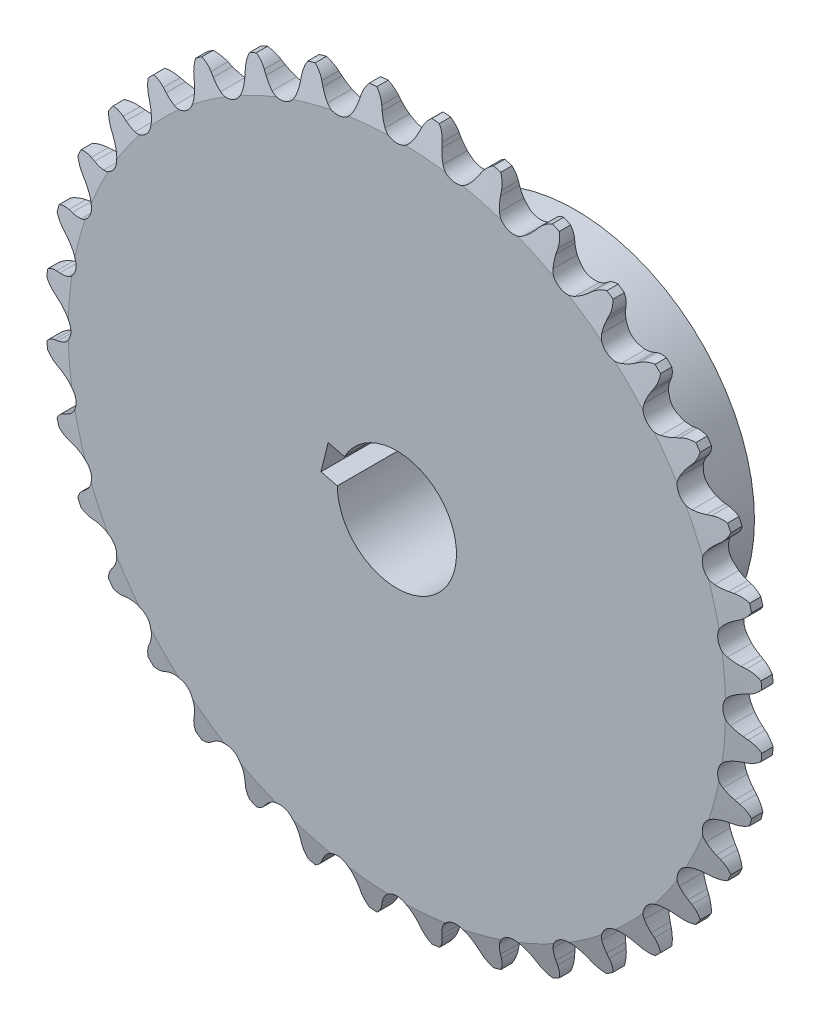
from build123d import *

# Parameters (mm, degrees)
TOOTH_CUT_NUMBER_OF_TEETH_36_DEPTH = 55.034537337
TOOTH_PATTERN_36_36_COUNT          = 36
SKETCH3_W                          = 16.256
SKETCH3_H                          = 19.05
SKETCH4_R                          = 6.35
CUT_EXTRUDE1_DEPTH                 = 58.127539121
CUT_EXTRUDE2_DEPTH                 = 58.127539121
SKETCH7_R                          = 1.5875
CUT_EXTRUDE3_DEPTH                 = 63.533576822
CUT_EXTRUDE3_DRAFT                 = 1
EXTRUDE1_REACH                     = 64.534
EXTRUDE1_END_RADIUS                = 19.05
SKETCH8_R                          = 1.685508898
CUT_EXTRUDE4_START                 = -2.54
CUT_EXTRUDE4_DEPTH                 = 60.993576851
CIRPATTERN1_START                  = 10.275861062
CIRPATTERN1_DEPTH                  = 8.774138938
EXTRUDE2_DEPTH                     = 19.05
CUT_EXTRUDE6_START                 = -19.05
CUT_EXTRUDE6_DEPTH                 = 19.05


# Read off the part's stored shape, not the designer's step: CirPattern1, Cut-Extrude6
with BuildPart() as part:
    # Sprocket-BaseSketch → 25 (04C) ANSI (ISO) Chain Number, 2.868in P.D. (revolve)
    with BuildSketch(Plane(origin=(0, 0, 0), x_dir=(0, 0, -1), z_dir=(1, 0, 0)), mode=Mode.PRIVATE) as f_25_04c_ansi_iso_chain_number_2_868i_sk:
        Polygon((1.397, 0), (1.397, 35.020416061), (0.60325, 38.195416061), (-0.60325, 38.195416061), (-1.397, 35.020416061), (-1.397, 0), align=None)
    revolve(f_25_04c_ansi_iso_chain_number_2_868i_sk.sketch.rotate(Axis((0, 0, -5.588), (0, 0, 1)), 90), axis=Axis((0, 0, -5.588), (0, 0, 1)))

    # Tooth-Sketch → Tooth-Cut, Number of teeth: 36 (cut, symmetric)
    with BuildSketch(Plane.XY):
        with BuildLine():
            Line((1.95260897, 36.506681097), (2.113680484, 36.943937247))
            ThreePointArc((2.113680484, 36.943937247), (3.086471, 38.204095605), (4.60520885, 38.681333297))
            ThreePointArc((4.60520885, 38.681333297), (0, 38.954505442), (-4.60520885, 38.681333297))
            ThreePointArc((-4.60520885, 38.681333297), (-3.086471, 38.204095605), (-2.113680484, 36.943937247))
            Line((-2.113680484, 36.943937247), (-1.95260897, 36.506681097))
            ThreePointArc((-1.95260897, 36.506681097), (-1.696264974, 35.939821607), (-1.361487812, 35.415449434))
            ThreePointArc((-1.361487812, 35.415449434), (0, 34.731684555), (1.361487812, 35.415449434))
            ThreePointArc((1.361487812, 35.415449434), (1.696264974, 35.939821607), (1.95260897, 36.506681097))
        make_face()
    tooth_cut_number_of_teeth_36 = extrude(amount=TOOTH_CUT_NUMBER_OF_TEETH_36_DEPTH, both=True, mode=Mode.SUBTRACT)

    # Tooth Pattern, 36 / 36: Tooth-Cut, Number of teeth: 36 ×36 about axis
    tooth_pattern_36_36_axis = Axis((0, 0, 0), (0, 0, 1))
    for i in range(1, TOOTH_PATTERN_36_36_COUNT):
        add(tooth_cut_number_of_teeth_36.rotate(tooth_pattern_36_36_axis, i * 360 / TOOTH_PATTERN_36_36_COUNT), mode=Mode.SUBTRACT)

    # Sketch3 → Hub-Revolve1 (revolve)
    with BuildSketch(Plane(origin=(0, 0, 0), x_dir=(0, 0, -1), z_dir=(1, 0, 0)), mode=Mode.PRIVATE) as hub_revolve1_sk:
        with Locations((9.525, 9.525)):
            Rectangle(SKETCH3_W, SKETCH3_H)
    revolve(hub_revolve1_sk.sketch.rotate(Axis((0, 0, 16.256), (0, 0, -1)), 90), axis=Axis((0, 0, 16.256), (0, 0, -1)))

    # Sketch4 → Cut-Extrude1 (cut, through all)
    with BuildSketch(Plane(origin=(0, 0, -17.653), x_dir=(-1, 0, 0), z_dir=(0, 0, -1))):
        Circle(SKETCH4_R)
    extrude(amount=-CUT_EXTRUDE1_DEPTH, mode=Mode.SUBTRACT)

    # Sketch6 → Cut-Extrude2 (cut, through all)
    with BuildSketch(Plane(origin=(0, 0, -17.653), x_dir=(-1, 0, 0), z_dir=(0, 0, -1))):
        Polygon((-1.045594108, 6.263324434), (-0.907234367, 7.844783517), (2.2556838, 7.568064034), (2.117324058, 5.98660495), align=None)
    extrude(amount=-CUT_EXTRUDE2_DEPTH, mode=Mode.SUBTRACT)


with BuildPart() as cut_extrude3_tool:
    # Sketch7 → Cut-Extrude3 (with draft: the straight prism first)
    with BuildSketch(Plane(origin=(-0.674224717, 7.706423775, 0), x_dir=(0.9961946980917455, 0.08715574274765885, 0), z_dir=(0.08715574274765883, -0.9961946980917454, 0))):
        with Locations((0, -9.525)):
            Circle(SKETCH7_R)
    extrude(amount=-CUT_EXTRUDE3_DEPTH)
    # Cut-Extrude3: the draft: its side faces are tilted about the plane it starts from
    cut_extrude3_sides = [cut_extrude3_tool.faces().sort_by_distance(p)[0] for p in [
        (-5.024341839, 39.213970224, -9.525),
    ]]
    draft(cut_extrude3_sides, Plane(origin=(-0.674224717, 7.706423775, 0), x_dir=(0.9961946980917455, 0.08715574274765885, 0), z_dir=(0.08715574274765883, -0.9961946980917454, 0)), CUT_EXTRUDE3_DRAFT)


with BuildPart() as part_1:
    add(part.part)

    # Cut-Extrude3: cut by cut_extrude3_tool
    add(cut_extrude3_tool.part, mode=Mode.SUBTRACT)

    # Extrude1: up to this cylinder (the profile starts inside it)
    extrude1_end = Plane(origin=(0, 0, -9.525), z_dir=(0, 0, 1)) * Cylinder(EXTRUDE1_END_RADIUS, 168.168, mode=Mode.PRIVATE)
    # Sketch8 → Extrude1 (add, up to the surface)
    with BuildSketch(Plane(origin=(-0.674224717, 7.706423775, 0), x_dir=(0.9961946980917455, 0.08715574274765885, 0), z_dir=(0.08715574274765883, -0.9961946980917454, 0)), mode=Mode.PRIVATE) as extrude1_sk1:
        with Locations((0, -9.525)):
            Circle(SKETCH8_R)
    extrude1_tool1 = extrude(extrude1_sk1.sketch, amount=-EXTRUDE1_REACH, mode=Mode.PRIVATE) & extrude1_end
    add(extrude1_tool1.solids().sort_by_distance((-0.674225, 7.706424, -9.525))[0])

    # Sketch9 → Cut-Extrude4 (cut, through all)
    with BuildSketch(Plane(origin=(-0.674224717, 7.706423775, 0), x_dir=(0.9961946980917455, 0.08715574274765885, 0), z_dir=(0.08715574274765883, -0.9961946980917454, 0)).offset(CUT_EXTRUDE4_START)):
        Polygon((0, -10.498129016), (0.842754449, -10.011564508), (0.842754449, -9.038435492), (0, -8.551870984), (-0.842754449, -9.038435492), (-0.842754449, -10.011564508), align=None)
    extrude(amount=-CUT_EXTRUDE4_DEPTH, mode=Mode.SUBTRACT)

    # CirPattern1 outline → CirPattern1 (cut)
    with BuildSketch(Plane(origin=(0, 0, 0), x_dir=(-0.08715574274765528, 0.9961946980917458, 0), z_dir=(0.9961946980917458, 0.08715574274765528, 0)).offset(CIRPATTERN1_START)):
        Polygon((-0.842754449, -10.011564508), (0, -10.498129016), (0.842754449, -10.011564508), (0.842754449, -9.038435492), (0, -8.551870984), (-0.842754449, -9.038435492), align=None)
    extrude(amount=CIRPATTERN1_DEPTH, mode=Mode.SUBTRACT)

    # CirPattern1 2 outline → CirPattern1 2 (revolve, cut)
    with BuildSketch(Plane(origin=(0, 0, -9.525), x_dir=(-0.08715574274765528, 0.9961946980917458, 0), z_dir=(0, 0, -1))):
        Polygon((1.685508898, 19.050010512), (1.685508898, 13.350787084), (1.784989729, 19.050040075), align=None)
    revolve(axis=Axis((0, 0, -9.525), (0.9961946980917458, 0.08715574274765528, 0)), mode=Mode.SUBTRACT)

    # Sketch11 → Extrude2 (add)
    with BuildSketch(Plane(origin=(0, 0, -17.653), x_dir=(-1, 0, 0), z_dir=(0, 0, -1))):
        with BuildLine():
            Line((-1.045594108, 6.263324434), (-0.907234367, 7.844783517))
            Line((-0.907234367, 7.844783517), (2.2556838, 7.568064034))
            Line((2.2556838, 7.568064034), (2.117324058, 5.98660495))
            ThreePointArc((2.117324058, 5.98660495), (0.553438966, 6.325836333), (-1.045594108, 6.263324434))
        make_face()
    extrude(amount=-EXTRUDE2_DEPTH)

    # Cut-Extrude6 outline → Cut-Extrude6 (cut)
    with BuildSketch(Plane.XY.offset(1.397).offset(CUT_EXTRUDE6_START)):
        with BuildLine():
            Line((-5.587111467, 3.017728526), (-7.323880631, 3.447438906))
            Line((-7.323880631, 3.447438906), (-8.086443238, 0.365374132))
            Line((-8.086443238, 0.365374132), (-6.349674074, -0.064336247))
            ThreePointArc((-6.349674074, -0.064336247), (-6.164129548, 1.525125215), (-5.587111467, 3.017728526))
        make_face()
    extrude(amount=CUT_EXTRUDE6_DEPTH, mode=Mode.SUBTRACT)


solid = part_1.part
